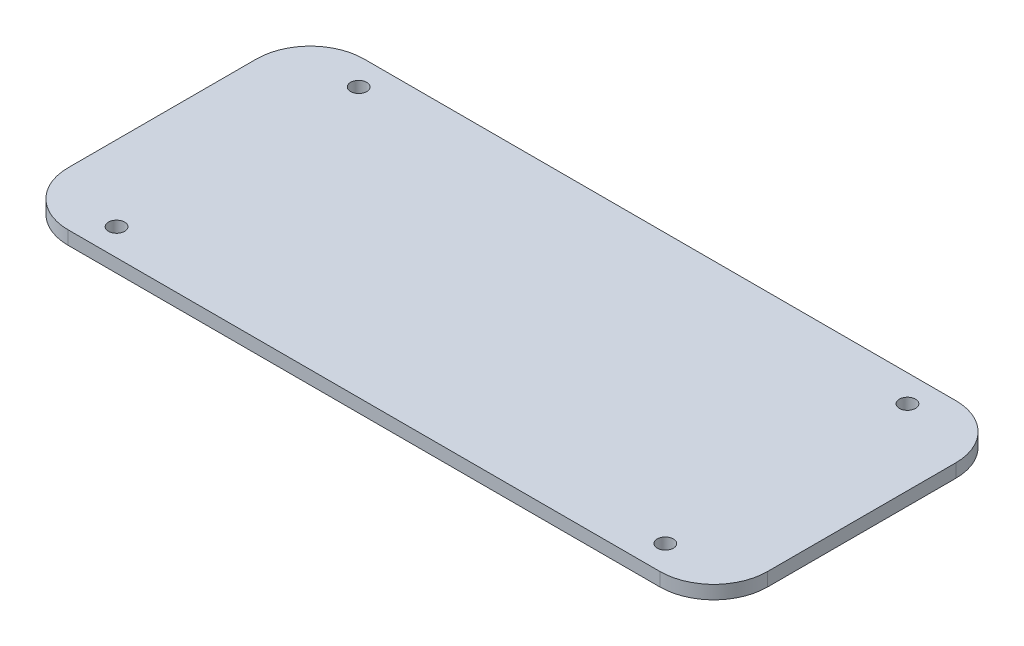
from build123d import *

# Parameters (mm, degrees)
BOSS_EXTRUDE1_DEPTH = 2.5
SKETCH2_R           = 1.5
CUT_EXTRUDE1_DEPTH  = 142.178079035


with BuildPart() as part:
    # Sketch1 → Boss-Extrude1 (new body)
    with BuildSketch(Plane(origin=(0, 0, 0), x_dir=(1, 0, 0), z_dir=(0, 1, 0))):
        with BuildLine():
            Line((10, 0), (120, 0))
            ThreePointArc((120, 0), (127.071067812, 2.928932188), (130, 10))
            Line((130, 10), (130, 45))
            ThreePointArc((130, 45), (127.071067812, 52.071067812), (120, 55))
            Line((120, 55), (10, 55))
            ThreePointArc((10, 55), (2.928932188, 52.071067812), (0, 45))
            Line((0, 45), (0, 10))
            ThreePointArc((0, 10), (2.928932188, 2.928932188), (10, 0))
        make_face()
    extrude(amount=BOSS_EXTRUDE1_DEPTH)

    # Sketch2 → Cut-Extrude1 (cut, through all)
    with BuildSketch(Plane(origin=(0, 2.5, 0), x_dir=(1, 0, 0), z_dir=(0, 1, 0))):
        with Locations((14, 5)):
            Circle(SKETCH2_R)
        with Locations((14, 50)):
            Circle(SKETCH2_R)
        with Locations((116, 5)):
            Circle(SKETCH2_R)
        with Locations((116, 50)):
            Circle(SKETCH2_R)
    extrude(amount=-CUT_EXTRUDE1_DEPTH, mode=Mode.SUBTRACT)


solid = part.part
